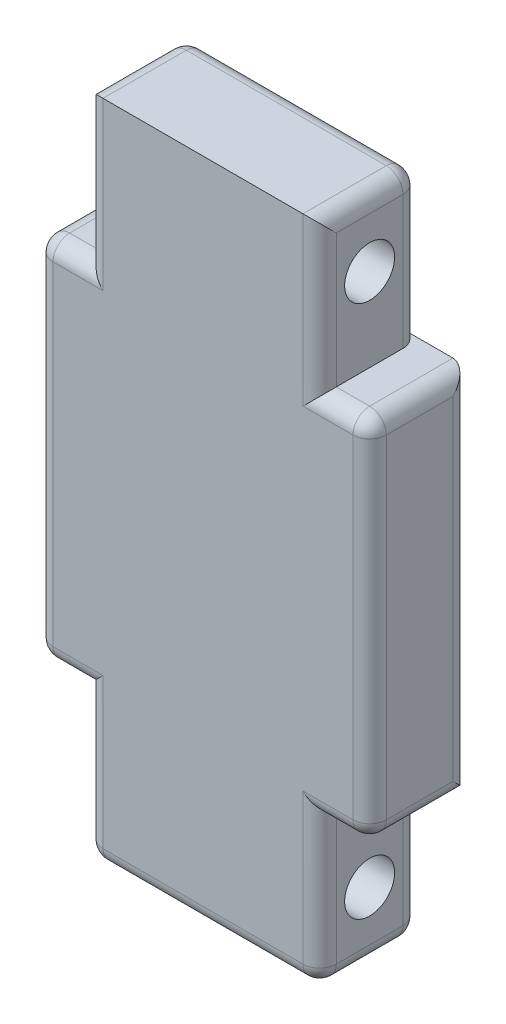
from build123d import *

# Parameters (mm, degrees)
SKETCH1_W                                  = 200
SKETCH1_H                                  = 400
BOSS_EXTRUDE1_DEPTH                        = 60
SKETCH2_R                                  = 15
CUT_EXTRUDE1_DEPTH                         = 452.220566907
SKETCH3_W                                  = 30
SKETCH3_H                                  = 90
CUT_EXTRUDE2_DEPTH                         = 452.220566907
MIRROR1_AT_THE_SECOND_PLANE_COPY_1_SKETC_W = 30
MIRROR1_AT_THE_SECOND_PLANE_COPY_1_SKETC_H = 90
MIRROR1_AT_THE_SECOND_PLANE_COPY_1_DEPTH   = 452.220566907
FILLET1_R                                  = 10
FILLET2_R                                  = 10


with BuildPart() as part:
    # Sketch1 → Boss-Extrude1 (new body)
    with BuildSketch(Plane.XY):
        with Locations((100, 200)):
            Rectangle(SKETCH1_W, SKETCH1_H)
    extrude(amount=BOSS_EXTRUDE1_DEPTH)

    # Sketch2 → Cut-Extrude1 (cut, through all)
    with BuildSketch(Plane(origin=(200, 0, 0), x_dir=(0, 0, -1), z_dir=(1, 0, 0))):
        with Locations(Location((-30, 40, 0), (0, 0, 90))):
            Circle(SKETCH2_R)
        with Locations(Location((-30, 360, 0), (0, 0, 90))):
            Circle(SKETCH2_R)
    extrude(amount=-CUT_EXTRUDE1_DEPTH, mode=Mode.SUBTRACT)

    # Sketch3 → Cut-Extrude2 (cut, through all)
    with BuildSketch(Plane(origin=(0, 0, 0), x_dir=(-1, 0, 0), z_dir=(0, 0, -1))):
        with Locations((-15, 45)):
            Rectangle(SKETCH3_W, SKETCH3_H)
    cut_extrude2 = extrude(amount=-CUT_EXTRUDE2_DEPTH, mode=Mode.SUBTRACT)

    # Mirror1: Cut-Extrude2 across plane
    add(cut_extrude2.mirror(Plane(origin=(100, 0, 0), x_dir=(0, 0, 1), z_dir=(1, 0, 0))), mode=Mode.SUBTRACT)

    # Mirror1 at the second plane: Cut-Extrude2 across plane
    add(cut_extrude2.mirror(Plane.ZX.offset(200)), mode=Mode.SUBTRACT)

    # Mirror1 at the second plane copy 1 sketc → Mirror1 at the second plane copy 1 (cut, through all)
    with BuildSketch(Plane(origin=(200, 400, 0), x_dir=(1, 0, 0), z_dir=(0, 0, -1))):
        with Locations((-15, 45)):
            Rectangle(MIRROR1_AT_THE_SECOND_PLANE_COPY_1_SKETC_W, MIRROR1_AT_THE_SECOND_PLANE_COPY_1_SKETC_H)
    extrude(amount=-MIRROR1_AT_THE_SECOND_PLANE_COPY_1_DEPTH, mode=Mode.SUBTRACT)

    # Fillet1
    fillet1_edges = [part.edges().sort_by_distance(p)[0] for p in [
        (100, 0, 0),
        (0, 90, 30),
        (30, 45, 60),
        (30, 0, 30),
        (15, 90, 60),
        (15, 90, 0),
        (30, 45, 0),
        (0, 200, 0),
        (0, 200, 60),
        (30, 355, 0),
        (15, 310, 0),
        (0, 310, 30),
        (30, 400, 30),
        (15, 310, 60),
        (30, 355, 60),
        (100, 400, 0),
    ]]
    fillet(fillet1_edges, radius=FILLET1_R)

    # Fillet2
    # the kernel refuses this fillet: 10 mm, written as the material it takes off along each edge
    with BuildSketch(Plane(origin=(40, 10, 50), x_dir=(0, -1, 0), z_dir=(0, 0, 1))) as fillet2_piece_1_section:
        Polygon((0, 0), (FILLET2_R, 0), (FILLET2_R, -FILLET2_R), (0, -FILLET2_R), align=None)
    fillet2_piece_1 = extrude(amount=FILLET2_R, mode=Mode.PRIVATE)
    fillet2_piece_1 = fillet2_piece_1 - Plane(origin=(40, 10, 50), x_dir=(0.7071067811865476, 0.7071067811865475, 0), z_dir=(0, 0, 1)) * Sphere(FILLET2_R, mode=Mode.PRIVATE)
    add(fillet2_piece_1, mode=Mode.SUBTRACT)
    with BuildSketch(Plane(origin=(190, 300, 50), x_dir=(1, 0, 0), z_dir=(0, 0, 1))) as fillet2_piece_2_section:
        Polygon((0, 0), (FILLET2_R, 0), (FILLET2_R, FILLET2_R), (0, FILLET2_R), align=None)
    fillet2_piece_2 = extrude(amount=FILLET2_R, mode=Mode.PRIVATE)
    fillet2_piece_2 = fillet2_piece_2 - Plane(origin=(190, 300, 50), x_dir=(-0.7071067811865471, -0.707106781186548, 0), z_dir=(0, 0, 1)) * Sphere(FILLET2_R, mode=Mode.PRIVATE)
    add(fillet2_piece_2, mode=Mode.SUBTRACT)
    with BuildSketch(Plane(origin=(190, 100, 50), x_dir=(0, -1, 0), z_dir=(0, 0, 1))) as fillet2_piece_3_section:
        Polygon((0, 0), (FILLET2_R, 0), (FILLET2_R, FILLET2_R), (0, FILLET2_R), align=None)
    fillet2_piece_3 = extrude(amount=FILLET2_R, mode=Mode.PRIVATE)
    fillet2_piece_3 = fillet2_piece_3 - Plane(origin=(190, 100, 50), x_dir=(-0.7071067811865472, 0.7071067811865478, 0), z_dir=(0, 0, 1)) * Sphere(FILLET2_R, mode=Mode.PRIVATE)
    add(fillet2_piece_3, mode=Mode.SUBTRACT)
    with BuildSketch(Plane(origin=(160, 10, 50), x_dir=(0, -1, 0), z_dir=(1, 0, 0))) as fillet2_piece_4_section:
        Polygon((0, 0), (FILLET2_R, 0), (FILLET2_R, -FILLET2_R), (0, -FILLET2_R), align=None)
    fillet2_piece_4 = extrude(amount=FILLET2_R, mode=Mode.PRIVATE)
    fillet2_piece_4 = fillet2_piece_4 - Plane(origin=(160, 10, 50), x_dir=(0, 0.7071067811865475, -0.7071067811865475), z_dir=(1, 0, 0)) * Sphere(FILLET2_R, mode=Mode.PRIVATE)
    add(fillet2_piece_4, mode=Mode.SUBTRACT)
    with BuildSketch(Plane(origin=(170, 10, 10), x_dir=(0, 0, -1), z_dir=(0, 1, 0))) as fillet2_piece_5:
        with BuildLine():
            CenterArc((10 - FILLET2_R, FILLET2_R), FILLET2_R, 270, 90)
            Line((10, FILLET2_R), (10, 0))
            Line((10, 0), (10 - FILLET2_R, 0))
        make_face()
    revolve(axis=Axis((170, 10, 10), (-1, 0, 0)), revolution_arc=90, mode=Mode.SUBTRACT)
    with BuildSketch(Plane(origin=(170, 390, 10), x_dir=(0, 0, -1), z_dir=(0, -1, 0))) as fillet2_piece_6:
        with BuildLine():
            CenterArc((10 - FILLET2_R, -FILLET2_R), FILLET2_R, 0, 90)
            Line((10, -FILLET2_R), (10, 0))
            Line((10, 0), (10 - FILLET2_R, 0))
        make_face()
    revolve(axis=Axis((170, 390, 10), (1, 0, 0)), revolution_arc=90, mode=Mode.SUBTRACT)
    with BuildSketch(Plane(origin=(200, 335, 0), x_dir=(-1, 0, 0), z_dir=(0, -1, 0))) as fillet2_piece_7:
        with BuildLine():
            CenterArc((FILLET2_R, -FILLET2_R), FILLET2_R, 90, 90)
            Line((0, -FILLET2_R), (0, 0))
            Line((0, 0), (FILLET2_R, 0))
        make_face()
    extrude(amount=270, mode=Mode.SUBTRACT)
    with BuildSketch(Plane(origin=(200, 300, 60), x_dir=(-1, 0, 0), z_dir=(0, -1, 0))) as fillet2_piece_8:
        with BuildLine():
            CenterArc((FILLET2_R, FILLET2_R), FILLET2_R, 180, 90)
            Line((0, FILLET2_R), (0, 0))
            Line((0, 0), (FILLET2_R, 0))
        make_face()
    extrude(amount=200, mode=Mode.SUBTRACT)
    with BuildSketch(Plane(origin=(170, 90, 0), x_dir=(-1, 0, 0), z_dir=(0, -1, 0))) as fillet2_piece_9:
        with BuildLine():
            CenterArc((FILLET2_R, -FILLET2_R), FILLET2_R, 90, 90)
            Line((0, -FILLET2_R), (0, 0))
            Line((0, 0), (FILLET2_R, 0))
        make_face()
    extrude(amount=80, mode=Mode.SUBTRACT)
    with BuildSketch(Plane(origin=(200, 90, -25), x_dir=(-1, 0, 0), z_dir=(0, 0, 1)), Plane(origin=(200, 310, -25), x_dir=(0, -1, 0), z_dir=(0, 0, 1)), Plane(origin=(170, 400, 10), x_dir=(0, -1, 0), z_dir=(0, 0, 1))) as fillet2_piece_10:
        with BuildLine():
            CenterArc((FILLET2_R, -FILLET2_R), FILLET2_R, 90, 90)
            Line((0, -FILLET2_R), (0, 0))
            Line((0, 0), (FILLET2_R, 0))
        make_face()
    extrude(amount=75, mode=Mode.SUBTRACT)
    with BuildSketch(Plane(origin=(170, 0, 10), x_dir=(0, 1, 0), z_dir=(0, 0, 1))) as fillet2_piece_11:
        with BuildLine():
            CenterArc((FILLET2_R, FILLET2_R), FILLET2_R, 180, 90)
            Line((0, FILLET2_R), (0, 0))
            Line((0, 0), (FILLET2_R, 0))
        make_face()
    extrude(amount=40, mode=Mode.SUBTRACT)
    with BuildSketch(Plane(origin=(190, 90, 60), x_dir=(0, 1, 0), z_dir=(-1, 0, 0))) as fillet2_piece_12:
        with BuildLine():
            CenterArc((FILLET2_R, FILLET2_R), FILLET2_R, 180, 90)
            Line((0, FILLET2_R), (0, 0))
            Line((0, 0), (FILLET2_R, 0))
        make_face()
    extrude(amount=20, mode=Mode.SUBTRACT)
    with BuildSketch(Plane(origin=(170, 90, 60), x_dir=(-1, 0, 0), z_dir=(0, -1, 0)), Plane(origin=(170, 310, 0), x_dir=(-1, 0, 0), z_dir=(0, 1, 0))) as fillet2_piece_13:
        with BuildLine():
            CenterArc((FILLET2_R, FILLET2_R), FILLET2_R, 180, 90)
            Line((0, FILLET2_R), (0, 0))
            Line((0, 0), (FILLET2_R, 0))
        make_face()
    extrude(amount=80, mode=Mode.SUBTRACT)
    with BuildSketch(Plane(origin=(170, 310, 60), x_dir=(-1, 0, 0), z_dir=(0, 1, 0))) as fillet2_piece_14:
        with BuildLine():
            CenterArc((FILLET2_R, -FILLET2_R), FILLET2_R, 90, 90)
            Line((0, -FILLET2_R), (0, 0))
            Line((0, 0), (FILLET2_R, 0))
        make_face()
    extrude(amount=115, mode=Mode.SUBTRACT)
    with BuildSketch(Plane(origin=(190, 310, 60), x_dir=(0, -1, 0), z_dir=(-1, 0, 0))) as fillet2_piece_15:
        with BuildLine():
            CenterArc((FILLET2_R, -FILLET2_R), FILLET2_R, 90, 90)
            Line((0, -FILLET2_R), (0, 0))
            Line((0, 0), (FILLET2_R, 0))
        make_face()
    extrude(amount=20, mode=Mode.SUBTRACT)
    with BuildSketch(Plane(origin=(160, 0, 60), x_dir=(0, 1, 0), z_dir=(-1, 0, 0))) as fillet2_piece_16:
        with BuildLine():
            CenterArc((FILLET2_R, FILLET2_R), FILLET2_R, 180, 90)
            Line((0, FILLET2_R), (0, 0))
            Line((0, 0), (FILLET2_R, 0))
        make_face()
    extrude(amount=120, mode=Mode.SUBTRACT)
    with BuildSketch(Plane(origin=(170, 115, 60), x_dir=(-1, 0, 0), z_dir=(0, -1, 0))) as fillet2_piece_17a_section:
        with BuildLine():
            CenterArc((FILLET2_R, FILLET2_R), FILLET2_R, 180, 90)
            Line((0, FILLET2_R), (0, 0))
            Line((0, 0), (FILLET2_R, 0))
        make_face()
    fillet2_piece_17a = extrude(amount=105, mode=Mode.PRIVATE)
    fillet2_piece_17a = split(fillet2_piece_17a, bisect_by=Plane(origin=(167.736048857, 90, 57.736048857), z_dir=(0, 1, 0)), keep=Keep.TOP, mode=Mode.PRIVATE)
    with BuildSketch(Plane(origin=(190, 90, 60), x_dir=(0, 1, 0), z_dir=(-1, 0, 0))) as fillet2_piece_17b_section:
        with BuildLine():
            CenterArc((FILLET2_R, FILLET2_R), FILLET2_R, 180, 90)
            Line((0, FILLET2_R), (0, 0))
            Line((0, 0), (FILLET2_R, 0))
        make_face()
    fillet2_piece_17b = extrude(amount=45, mode=Mode.PRIVATE)
    fillet2_piece_17b = split(fillet2_piece_17b, bisect_by=Plane(origin=(170, 92.263951143, 57.736048857), z_dir=(-1, 0, 0)), keep=Keep.TOP, mode=Mode.PRIVATE)
    fillet2_piece_17 = fillet2_piece_17a & fillet2_piece_17b
    add(fillet2_piece_17, mode=Mode.SUBTRACT)
    with BuildSketch(Plane(origin=(190, 310, 60), x_dir=(0, -1, 0), z_dir=(-1, 0, 0))) as fillet2_piece_18a_section:
        with BuildLine():
            CenterArc((FILLET2_R, -FILLET2_R), FILLET2_R, 90, 90)
            Line((0, -FILLET2_R), (0, 0))
            Line((0, 0), (FILLET2_R, 0))
        make_face()
    fillet2_piece_18a = extrude(amount=45, mode=Mode.PRIVATE)
    fillet2_piece_18a = split(fillet2_piece_18a, bisect_by=Plane(origin=(170, 307.736048857, 57.736048857), z_dir=(-1, 0, 0)), keep=Keep.TOP, mode=Mode.PRIVATE)
    with BuildSketch(Plane(origin=(170, 285, 60), x_dir=(-1, 0, 0), z_dir=(0, 1, 0))) as fillet2_piece_18b_section:
        with BuildLine():
            CenterArc((FILLET2_R, -FILLET2_R), FILLET2_R, 90, 90)
            Line((0, -FILLET2_R), (0, 0))
            Line((0, 0), (FILLET2_R, 0))
        make_face()
    fillet2_piece_18b = extrude(amount=140, mode=Mode.PRIVATE)
    fillet2_piece_18b = split(fillet2_piece_18b, bisect_by=Plane(origin=(167.736048857, 310, 57.736048857), z_dir=(0, -1, 0)), keep=Keep.TOP, mode=Mode.PRIVATE)
    fillet2_piece_18 = fillet2_piece_18a & fillet2_piece_18b
    add(fillet2_piece_18, mode=Mode.SUBTRACT)


solid = part.part
